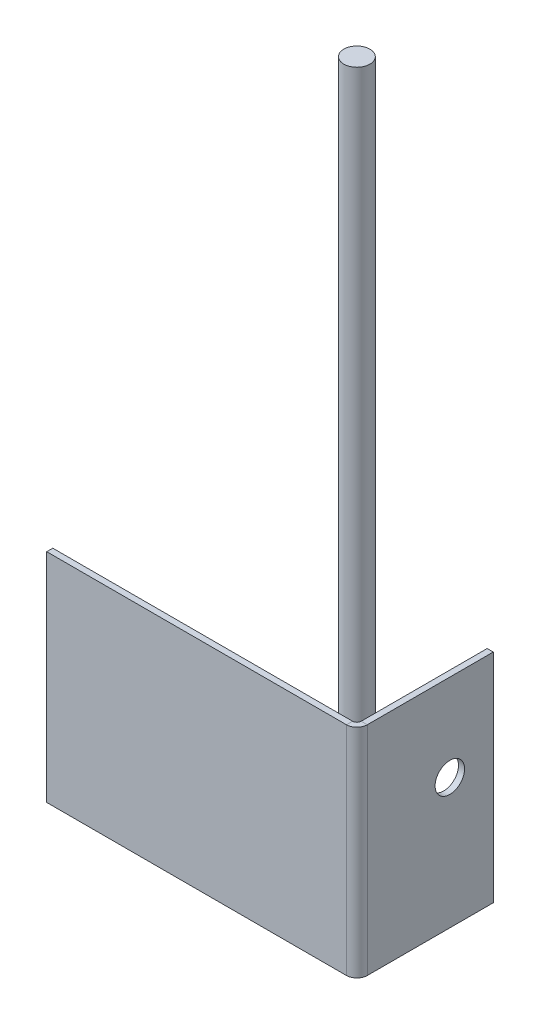
from build123d import *

# Parameters (mm, degrees)
SKETCH1_W                    = 35
SKETCH1_H                    = 25
BASE_FLANGE1_DEPTH           = 0.7
SKETCH6_R                    = 1.5
BOSS_EXTRUDE1_DEPTH          = 90
EDGE_FLANGE1_STRIP_W         = 3.8
EDGE_FLANGE1_STRIP_H         = 0.7
EDGE_FLANGE1_STRIP_CUT_DEPTH = 25
EDGE_FLANGE1_DEPTH           = 25
SKETCH10_R                   = 1.695993735
CUT_EXTRUDE1_DEPTH           = 0.7


# Sheet-metal steps are written as plain solids
with BuildPart() as part:
    # Sketch1 → Base-Flange1 (new body)
    with BuildSketch(Plane.XY):
        Rectangle(SKETCH1_W, SKETCH1_H)
    extrude(amount=-BASE_FLANGE1_DEPTH)

    # Edge-Flange1 strip (across the edge) → Edge-Flange1 strip cut (cut)
    with BuildSketch(Plane(origin=(17.5, 12.5, -0.7), x_dir=(-1, 0, 0), z_dir=(0, -1, 0))):
        with Locations((-1.4, -0.35)):
            Rectangle(EDGE_FLANGE1_STRIP_W, EDGE_FLANGE1_STRIP_H)
    extrude(amount=EDGE_FLANGE1_STRIP_CUT_DEPTH, mode=Mode.SUBTRACT)

    # Edge-Flange1 section (across the edge) → Edge-Flange1 (add)
    with BuildSketch(Plane(origin=(17.5, 12.5, -0.7), x_dir=(-1, 0, 0), z_dir=(0, -1, 0))):
        with BuildLine():
            Line((-0.7, 0.5), (-0.7, 15))
            Line((-0.7, 15), (0, 15))
            Line((0, 15), (0, 0.5))
            ThreePointArc((0, 0.5), (0.146446609, 0.146446609), (0.5, 0))
            Line((0.5, 0), (0.5, -0.7))
            ThreePointArc((0.5, -0.7), (-0.348528137, -0.348528137), (-0.7, 0.5))
        make_face()
    extrude(amount=EDGE_FLANGE1_DEPTH)

    # Sketch10 → Cut-Extrude1 (cut)
    with BuildSketch(Plane.ZY.offset(-17.5)):
        with Locations((-10.7, 2.5)):
            Circle(SKETCH10_R)
    extrude(amount=-CUT_EXTRUDE1_DEPTH, mode=Mode.SUBTRACT)


with BuildPart() as body_2:
    # Sketch6 → Boss-Extrude1 (new body)
    with BuildSketch(Plane(origin=(0, -12.5, 0), x_dir=(1, 0, 0), z_dir=(0, 1, 0))):
        with Locations(Location((16, 2.2, 0), (0, 0, 90))):
            Circle(SKETCH6_R)
    extrude(amount=BOSS_EXTRUDE1_DEPTH)


solid = Compound([part.part, body_2.part])
